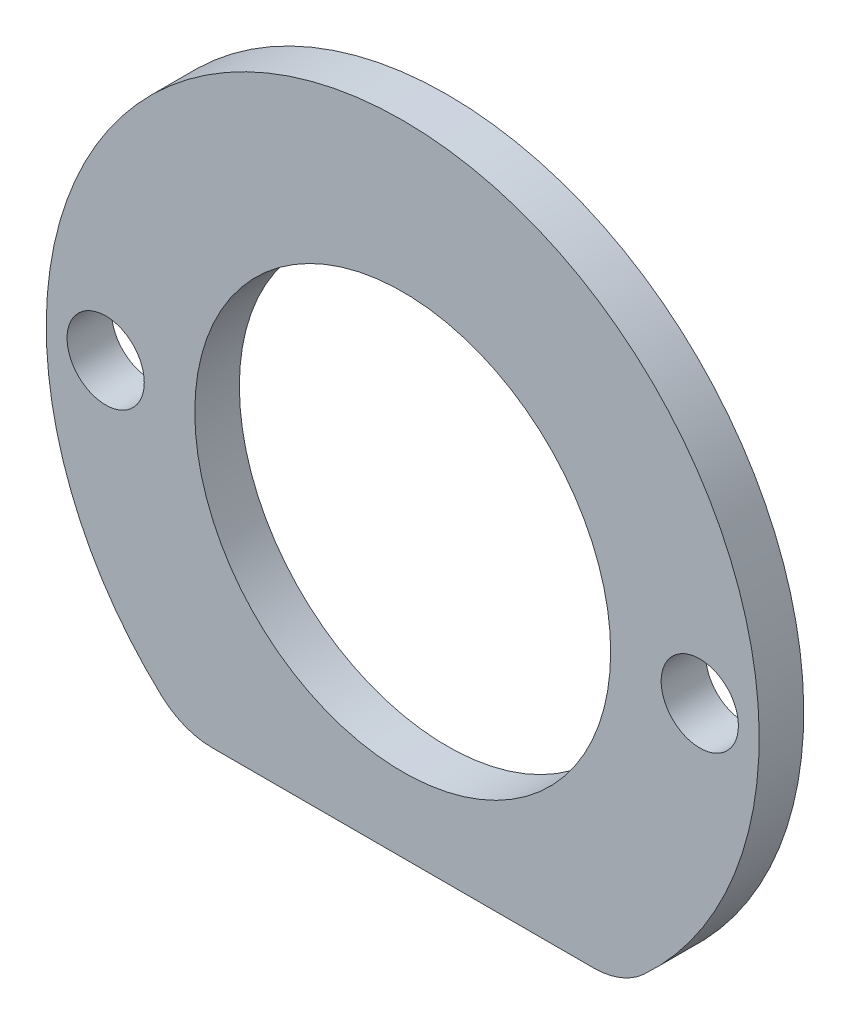
from build123d import *

# Parameters (mm, degrees)
ESBO_O1_R                = 2.6
ESBO_O1_R_2              = 14
RESSALTO_EXTRUS_O1_DEPTH = 3
FILETE1_R                = 5


with BuildPart() as part:
    # Esboço1 → Ressalto-extrusão1 (new body)
    with BuildSketch(Plane.XY):
        with BuildLine():
            Line((-14.662878299, -19), (14.662878299, -19))
            ThreePointArc((14.662878299, -19), (21.539603979, -10.585152829), (24, 0))
            ThreePointArc((24, 0), (-10.585152829, 21.539603979), (-14.662878299, -19))
        make_face()
        with Locations((-20, 0)):
            Circle(ESBO_O1_R, mode=Mode.SUBTRACT)
        Circle(ESBO_O1_R_2, mode=Mode.SUBTRACT)
        with Locations((20, 0)):
            Circle(ESBO_O1_R, mode=Mode.SUBTRACT)
    extrude(amount=RESSALTO_EXTRUS_O1_DEPTH)

    # Filete1
    filete1_edges = [part.edges().sort_by_distance(p)[0] for p in [
        (-14.662878299, -19, 1.5),
        (14.662878299, -19, 1.5),
    ]]
    fillet(filete1_edges, radius=FILETE1_R)


solid = part.part
